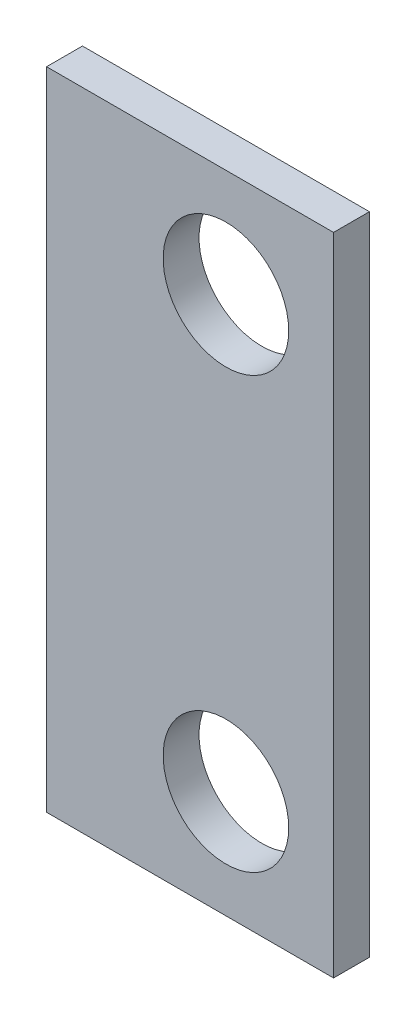
from build123d import *

# Parameters (mm, degrees)
SKETCH1_W           = 50.8
SKETCH1_H           = 6.35
BOSS_EXTRUDE1_DEPTH = 114.3
SKETCH2_R           = 11.1125
CUT_EXTRUDE1_DEPTH  = 126.241576563


with BuildPart() as part:
    # Sketch1 → Boss-Extrude1 (new body)
    with BuildSketch(Plane(origin=(0, 0, 0), x_dir=(1, 0, 0), z_dir=(0, 1, 0))):
        with Locations((25.4, 3.175)):
            Rectangle(SKETCH1_W, SKETCH1_H)
    extrude(amount=BOSS_EXTRUDE1_DEPTH)

    # Sketch2 → Cut-Extrude1 (cut, through all)
    with BuildSketch(Plane.XY):
        with Locations((31.75, 19.05)):
            Circle(SKETCH2_R)
        with Locations((31.75, 95.25)):
            Circle(SKETCH2_R)
    extrude(amount=-CUT_EXTRUDE1_DEPTH, mode=Mode.SUBTRACT)


solid = part.part
